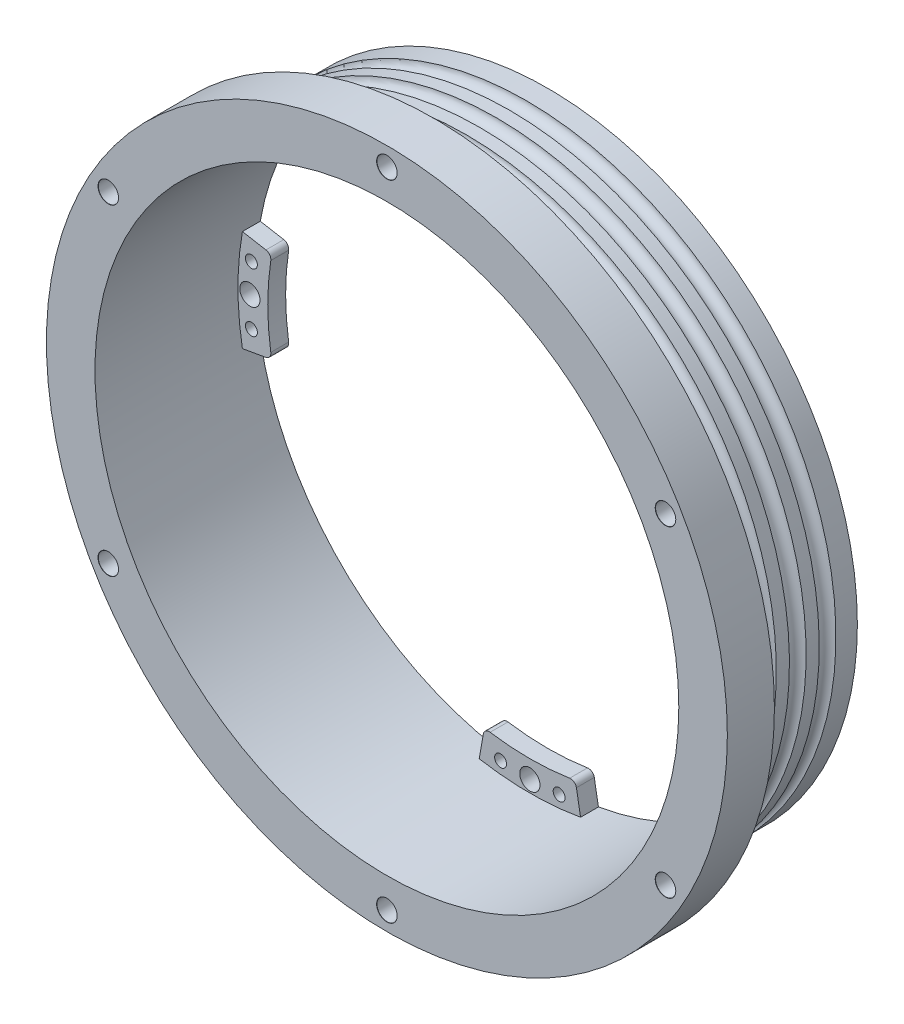
from build123d import *

# Parameters (mm, degrees)
SKETCH_1_R                   = 51.975
SKETCH_1_R_2                 = 49
EXTRUDE_1_DEPTH              = 19.1
SKETCH_2_R                   = 57.15
SKETCH_2_R_2                 = 49
EXTRUDE_2_DEPTH              = 7.9
EXTRUDE_3_DEPTH              = 3
HOLE_WIZARD_M3_1_D           = 3.4
HOLE_WIZARD_M3_1_CSINK_D     = 3.45
HOLE_WIZARD_M3_1_CSINK_ANGLE = 82
CUT_EXTRUDE_1_REACH          = 87.213
SKETCH_6_R                   = 1
SKETCH_12_R                  = 1.4


# Read off the part's stored shape, not the designer's step: M3 すきま穴3
with BuildPart() as part:
    # ｽｹｯﾁ1 → ﾎﾞｽ - 押し出し1 (new body)
    with BuildSketch(Plane.XY):
        Circle(SKETCH_1_R)
        Circle(SKETCH_1_R_2, mode=Mode.SUBTRACT)
    extrude(amount=EXTRUDE_1_DEPTH)

    # ｽｹｯﾁ2 → ﾎﾞｽ - 押し出し2 (add)
    with BuildSketch(Plane.XY.offset(19.1)):
        Circle(SKETCH_2_R)
        Circle(SKETCH_2_R_2, mode=Mode.SUBTRACT)
    extrude(amount=EXTRUDE_2_DEPTH)

    # ｽｹｯﾁ3 → ﾎﾞｽ - 押し出し3 (add)
    with BuildSketch(Plane(origin=(0, 0, 0), x_dir=(-1, 0, 0), z_dir=(0, 0, -1))):
        with BuildLine():
            Line((7.812238333, 44.305405226), (8.508760706, 48.255579898))
            ThreePointArc((8.508760706, 48.255579898), (0, 49), (-8.508760706, 48.255579898))
            Line((-8.508760706, 48.255579898), (-7.812238333, 44.305405226))
            ThreePointArc((-7.812238333, 44.305405226), (-7.410073856, 43.666325397), (-6.6757099, 43.490629995))
            ThreePointArc((-6.6757099, 43.490629995), (0, 44), (6.6757099, 43.490629995))
            ThreePointArc((6.6757099, 43.490629995), (7.410073856, 43.666325397), (7.812238333, 44.305405226))
        make_face()
        with BuildLine():
            Line((44.305405226, -7.812238333), (48.255579898, -8.508760706))
            ThreePointArc((48.255579898, -8.508760706), (49, 0), (48.255579898, 8.508760706))
            Line((48.255579898, 8.508760706), (44.305405226, 7.812238333))
            ThreePointArc((44.305405226, 7.812238333), (43.666325397, 7.410073856), (43.490629995, 6.6757099))
            ThreePointArc((43.490629995, 6.6757099), (44, 0), (43.490629995, -6.6757099))
            ThreePointArc((43.490629995, -6.6757099), (43.666325397, -7.410073856), (44.305405226, -7.812238333))
        make_face()
        with BuildLine():
            Line((-7.812238333, -44.305405226), (-8.508760706, -48.255579898))
            ThreePointArc((-8.508760706, -48.255579898), (0, -49), (8.508760706, -48.255579898))
            Line((8.508760706, -48.255579898), (7.812238333, -44.305405226))
            ThreePointArc((7.812238333, -44.305405226), (7.410073856, -43.666325397), (6.6757099, -43.490629995))
            ThreePointArc((6.6757099, -43.490629995), (0, -44), (-6.6757099, -43.490629995))
            ThreePointArc((-6.6757099, -43.490629995), (-7.410073856, -43.666325397), (-7.812238333, -44.305405226))
        make_face()
        with BuildLine():
            Line((-44.305405226, 7.812238333), (-48.255579898, 8.508760706))
            ThreePointArc((-48.255579898, 8.508760706), (-49, 0), (-48.255579898, -8.508760706))
            Line((-48.255579898, -8.508760706), (-44.305405226, -7.812238333))
            ThreePointArc((-44.305405226, -7.812238333), (-43.666325397, -7.410073856), (-43.490629995, -6.6757099))
            ThreePointArc((-43.490629995, -6.6757099), (-44, 0), (-43.490629995, 6.6757099))
            ThreePointArc((-43.490629995, 6.6757099), (-43.666325397, 7.410073856), (-44.305405226, 7.812238333))
        make_face()
    extrude(amount=-EXTRUDE_3_DEPTH)

    # M3 すきま穴1 (through all)
    with Locations(Plane(origin=(0, 0, 0), x_dir=(-1, 0, 0), z_dir=(0, 0, -1))):
        with Locations((-47, 0), (0, 47), (47, 0), (0, -47)):
            CounterSinkHole(HOLE_WIZARD_M3_1_D / 2, HOLE_WIZARD_M3_1_CSINK_D / 2, counter_sink_angle=HOLE_WIZARD_M3_1_CSINK_ANGLE)

    # ｽｹｯﾁ6 → ｶｯﾄ - 押し出し1 (cut, up to next)
    with BuildSketch(Plane(origin=(0, 0, 0), x_dir=(-1, 0, 0), z_dir=(0, 0, -1)), mode=Mode.PRIVATE) as cut_extrude_1_sk1:
        with Locations((4.912837774, 46.742529082)):
            Circle(SKETCH_6_R)
    cut_extrude_1_tool1 = extrude(cut_extrude_1_sk1.sketch, amount=-CUT_EXTRUDE_1_REACH, mode=Mode.PRIVATE) & part.part
    # ｽｹｯﾁ6 → ｶｯﾄ - 押し出し1 (cut, up to next)
    with BuildSketch(Plane(origin=(0, 0, 0), x_dir=(-1, 0, 0), z_dir=(0, 0, -1)), mode=Mode.PRIVATE) as cut_extrude_1_sk2:
        with Locations((-4.912837774, 46.742529082)):
            Circle(SKETCH_6_R)
    cut_extrude_1_tool2 = extrude(cut_extrude_1_sk2.sketch, amount=-CUT_EXTRUDE_1_REACH, mode=Mode.PRIVATE) & part.part
    # ｽｹｯﾁ6 → ｶｯﾄ - 押し出し1 (cut, up to next)
    with BuildSketch(Plane(origin=(0, 0, 0), x_dir=(-1, 0, 0), z_dir=(0, 0, -1)), mode=Mode.PRIVATE) as cut_extrude_1_sk3:
        with Locations((46.742529082, 4.912837774)):
            Circle(SKETCH_6_R)
    cut_extrude_1_tool3 = extrude(cut_extrude_1_sk3.sketch, amount=-CUT_EXTRUDE_1_REACH, mode=Mode.PRIVATE) & part.part
    # ｽｹｯﾁ6 → ｶｯﾄ - 押し出し1 (cut, up to next)
    with BuildSketch(Plane(origin=(0, 0, 0), x_dir=(-1, 0, 0), z_dir=(0, 0, -1)), mode=Mode.PRIVATE) as cut_extrude_1_sk4:
        with Locations((46.742529082, -4.912837774)):
            Circle(SKETCH_6_R)
    cut_extrude_1_tool4 = extrude(cut_extrude_1_sk4.sketch, amount=-CUT_EXTRUDE_1_REACH, mode=Mode.PRIVATE) & part.part
    # ｽｹｯﾁ6 → ｶｯﾄ - 押し出し1 (cut, up to next)
    with BuildSketch(Plane(origin=(0, 0, 0), x_dir=(-1, 0, 0), z_dir=(0, 0, -1)), mode=Mode.PRIVATE) as cut_extrude_1_sk5:
        with Locations((4.912837774, -46.742529082)):
            Circle(SKETCH_6_R)
    cut_extrude_1_tool5 = extrude(cut_extrude_1_sk5.sketch, amount=-CUT_EXTRUDE_1_REACH, mode=Mode.PRIVATE) & part.part
    # ｽｹｯﾁ6 → ｶｯﾄ - 押し出し1 (cut, up to next)
    with BuildSketch(Plane(origin=(0, 0, 0), x_dir=(-1, 0, 0), z_dir=(0, 0, -1)), mode=Mode.PRIVATE) as cut_extrude_1_sk6:
        with Locations((-4.912837774, -46.742529082)):
            Circle(SKETCH_6_R)
    cut_extrude_1_tool6 = extrude(cut_extrude_1_sk6.sketch, amount=-CUT_EXTRUDE_1_REACH, mode=Mode.PRIVATE) & part.part
    # ｽｹｯﾁ6 → ｶｯﾄ - 押し出し1 (cut, up to next)
    with BuildSketch(Plane(origin=(0, 0, 0), x_dir=(-1, 0, 0), z_dir=(0, 0, -1)), mode=Mode.PRIVATE) as cut_extrude_1_sk7:
        with Locations((-46.742529082, -4.912837774)):
            Circle(SKETCH_6_R)
    cut_extrude_1_tool7 = extrude(cut_extrude_1_sk7.sketch, amount=-CUT_EXTRUDE_1_REACH, mode=Mode.PRIVATE) & part.part
    # ｽｹｯﾁ6 → ｶｯﾄ - 押し出し1 (cut, up to next)
    with BuildSketch(Plane(origin=(0, 0, 0), x_dir=(-1, 0, 0), z_dir=(0, 0, -1)), mode=Mode.PRIVATE) as cut_extrude_1_sk8:
        with Locations((-46.742529082, 4.912837774)):
            Circle(SKETCH_6_R)
    cut_extrude_1_tool8 = extrude(cut_extrude_1_sk8.sketch, amount=-CUT_EXTRUDE_1_REACH, mode=Mode.PRIVATE) & part.part
    add(cut_extrude_1_tool1.solids().sort_by_distance((-4.912838, 46.742529, 0))[0], mode=Mode.SUBTRACT)
    add(cut_extrude_1_tool2.solids().sort_by_distance((4.912838, 46.742529, 0))[0], mode=Mode.SUBTRACT)
    add(cut_extrude_1_tool3.solids().sort_by_distance((-46.742529, 4.912838, 0))[0], mode=Mode.SUBTRACT)
    add(cut_extrude_1_tool4.solids().sort_by_distance((-46.742529, -4.912838, 0))[0], mode=Mode.SUBTRACT)
    add(cut_extrude_1_tool5.solids().sort_by_distance((-4.912838, -46.742529, 0))[0], mode=Mode.SUBTRACT)
    add(cut_extrude_1_tool6.solids().sort_by_distance((4.912838, -46.742529, 0))[0], mode=Mode.SUBTRACT)
    add(cut_extrude_1_tool7.solids().sort_by_distance((46.742529, -4.912838, 0))[0], mode=Mode.SUBTRACT)
    add(cut_extrude_1_tool8.solids().sort_by_distance((46.742529, 4.912838, 0))[0], mode=Mode.SUBTRACT)

    # M3 すきま穴3 outline → M3 すきま穴3 (revolve, cut)
    with BuildSketch(Plane(origin=(-46.765371804, 27, 0), x_dir=(1, 0, 0), z_dir=(0, -1, 0))):
        Polygon((0, 19.1), (1.7, 19.1), (1.7, 26.97124079), (1.725, 27), (0, 27), align=None)
    revolve(axis=Axis((-46.765371804, 27, 0), (0, 0, 1)), mode=Mode.SUBTRACT)

    # Hole Wizard M3 _3 2 outline → Hole Wizard M3 _3 2 (revolve, cut)
    with BuildSketch(Plane(origin=(-46.765371804, -27, 0), x_dir=(1, 0, 0), z_dir=(0, -1, 0))):
        Polygon((0, 19.1), (1.7, 19.1), (1.7, 26.97124079), (1.725, 27), (0, 27), align=None)
    revolve(axis=Axis((-46.765371804, -27, 0), (0, 0, 1)), mode=Mode.SUBTRACT)

    # Hole Wizard M3 _3 3 outline → Hole Wizard M3 _3 3 (revolve, cut)
    with BuildSketch(Plane.XZ.offset(54)):
        Polygon((0, 19.1), (1.7, 19.1), (1.7, 26.97124079), (1.725, 27), (0, 27), align=None)
    revolve(axis=Axis((0, -54, 0), (0, 0, 1)), mode=Mode.SUBTRACT)

    # Hole Wizard M3 _3 4 outline → Hole Wizard M3 _3 4 (revolve, cut)
    with BuildSketch(Plane(origin=(46.765371804, -27, 0), x_dir=(1, 0, 0), z_dir=(0, -1, 0))):
        Polygon((0, 19.1), (1.7, 19.1), (1.7, 26.97124079), (1.725, 27), (0, 27), align=None)
    revolve(axis=Axis((46.765371804, -27, 0), (0, 0, 1)), mode=Mode.SUBTRACT)

    # Hole Wizard M3 _3 5 outline → Hole Wizard M3 _3 5 (revolve, cut)
    with BuildSketch(Plane(origin=(46.765371804, 27, 0), x_dir=(1, 0, 0), z_dir=(0, -1, 0))):
        Polygon((0, 19.1), (1.7, 19.1), (1.7, 26.97124079), (1.725, 27), (0, 27), align=None)
    revolve(axis=Axis((46.765371804, 27, 0), (0, 0, 1)), mode=Mode.SUBTRACT)

    # Hole Wizard M3 _3 6 outline → Hole Wizard M3 _3 6 (revolve, cut)
    with BuildSketch(Plane.XZ.offset(-54)):
        Polygon((0, 19.1), (1.7, 19.1), (1.7, 26.97124079), (1.725, 27), (0, 27), align=None)
    revolve(axis=Axis((0, 54, 0), (0, 0, 1)), mode=Mode.SUBTRACT)

    # ｽｹｯﾁ12 → ｶｯﾄ - 回転1 (revolve, cut)
    with BuildSketch(Plane(origin=(0, 0, 0), x_dir=(0, 0, -1), z_dir=(1, 0, 0))):
        with Locations((-5, 51.975)):
            Circle(SKETCH_12_R)
        with Locations((-10, 51.975)):
            Circle(SKETCH_12_R)
        with Locations((-15, 51.975)):
            Circle(SKETCH_12_R)
    revolve(axis=Axis((0, 0, 0), (0, 0, 1)), mode=Mode.SUBTRACT)


solid = part.part
